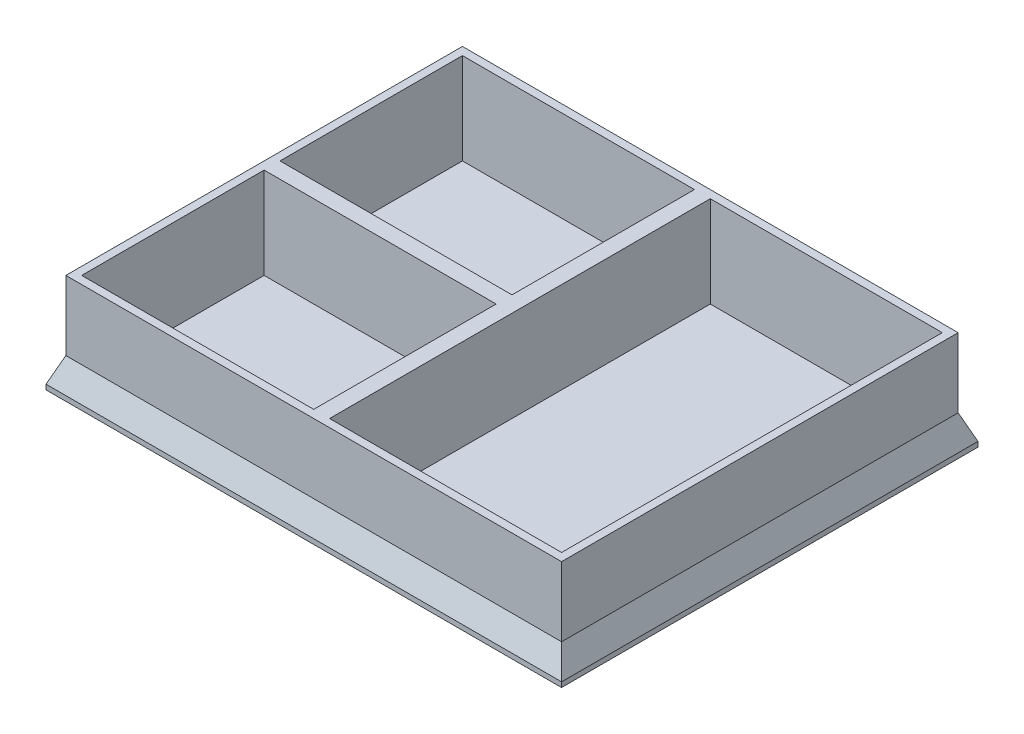
from build123d import *
from OCP.BRepFilletAPI import BRepFilletAPI_MakeChamfer

# Parameters (mm, degrees)
SKICA1_W                = 100
SKICA1_H                = 80
SKICA1_W_2              = 46.8
SKICA1_H_2              = 36.8
SKICA1_H_3              = 76.8
P_IDAT_VYSUNUT_M1_DEPTH = 20
SKICA1_6_W              = 104
SKICA1_6_H              = 84
P_IDAT_VYSUNUT_M3_DEPTH = 1.6
SKICA1_7_W              = 104
SKICA1_7_H              = 84
SKICA1_7_W_2            = 100
SKICA1_7_H_2            = 80
P_IDAT_VYSUNUT_M4_DEPTH = 6
ZKOSEN_14_SIZE          = 2
ZKOSEN_14_SIZE_2        = 5


with BuildPart() as part:
    # Skica1 → Přidat vysunutím1 (new body)
    with BuildSketch(Plane(origin=(0, 0, 0), x_dir=(1, 0, 0), z_dir=(0, 1, 0))):
        Rectangle(SKICA1_W, SKICA1_H)
        with Locations((-25, 20)):
            Rectangle(SKICA1_W_2, SKICA1_H_2, mode=Mode.SUBTRACT)
        with Locations((-25, -20)):
            Rectangle(SKICA1_W_2, SKICA1_H_2, mode=Mode.SUBTRACT)
        with Locations((25, 0)):
            Rectangle(SKICA1_W_2, SKICA1_H_3, mode=Mode.SUBTRACT)
    extrude(amount=P_IDAT_VYSUNUT_M1_DEPTH)

    # Skica1<6> → Přidat vysunutím3 (add)
    with BuildSketch(Plane(origin=(0, 0, 0), x_dir=(1, 0, 0), z_dir=(0, 1, 0))):
        Rectangle(SKICA1_6_W, SKICA1_6_H)
    extrude(amount=P_IDAT_VYSUNUT_M3_DEPTH)

    # Skica1<7> → Přidat vysunutím4 (add)
    with BuildSketch(Plane(origin=(0, 0, 0), x_dir=(1, 0, 0), z_dir=(0, 1, 0))):
        Rectangle(SKICA1_7_W, SKICA1_7_H)
        Rectangle(SKICA1_7_W_2, SKICA1_7_H_2, mode=Mode.SUBTRACT)
    extrude(amount=P_IDAT_VYSUNUT_M4_DEPTH)

    # Zkosení14
    zkosen_14_edges_1 = [part.edges().sort_by_distance(p)[0] for p in [
        (52, 6, 0),
    ]]
    zkosen_14_side_1 = [part.faces().sort_by_distance(p)[0] for p in [
        (51.96, 6, 0),
    ]]
    zkosen_14_edges_2 = [part.edges().sort_by_distance(p)[0] for p in [
        (0, 6, -42),
    ]]
    zkosen_14_side_2 = [part.faces().sort_by_distance(p)[0] for p in [
        (0, 6, -41.96),
    ]]
    zkosen_14_edges_3 = [part.edges().sort_by_distance(p)[0] for p in [
        (-52, 6, 0),
    ]]
    zkosen_14_side_3 = [part.faces().sort_by_distance(p)[0] for p in [
        (-52, 5.96, 0),
    ]]
    zkosen_14_edges_4 = [part.edges().sort_by_distance(p)[0] for p in [
        (0, 6, 42),
    ]]
    zkosen_14_side_4 = [part.faces().sort_by_distance(p)[0] for p in [
        (0, 6, 41.96),
    ]]
    zkosen_14 = BRepFilletAPI_MakeChamfer(part.part.solid().wrapped)
    for e in zkosen_14_edges_1:
        zkosen_14.Add(ZKOSEN_14_SIZE - 0.0001, ZKOSEN_14_SIZE_2 - 0.0001, e.wrapped, zkosen_14_side_1[0].wrapped)
    for e in zkosen_14_edges_2:
        zkosen_14.Add(ZKOSEN_14_SIZE - 0.0001, ZKOSEN_14_SIZE_2 - 0.0001, e.wrapped, zkosen_14_side_2[0].wrapped)
    for e in zkosen_14_edges_3:
        zkosen_14.Add(ZKOSEN_14_SIZE_2 - 0.0001, ZKOSEN_14_SIZE - 0.0001, e.wrapped, zkosen_14_side_3[0].wrapped)
    for e in zkosen_14_edges_4:
        zkosen_14.Add(ZKOSEN_14_SIZE - 0.0001, ZKOSEN_14_SIZE_2 - 0.0001, e.wrapped, zkosen_14_side_4[0].wrapped)
    add(Compound.cast(zkosen_14.Shape()), mode=Mode.REPLACE)  # a hair under: the kernel refuses the full size


solid = part.part
